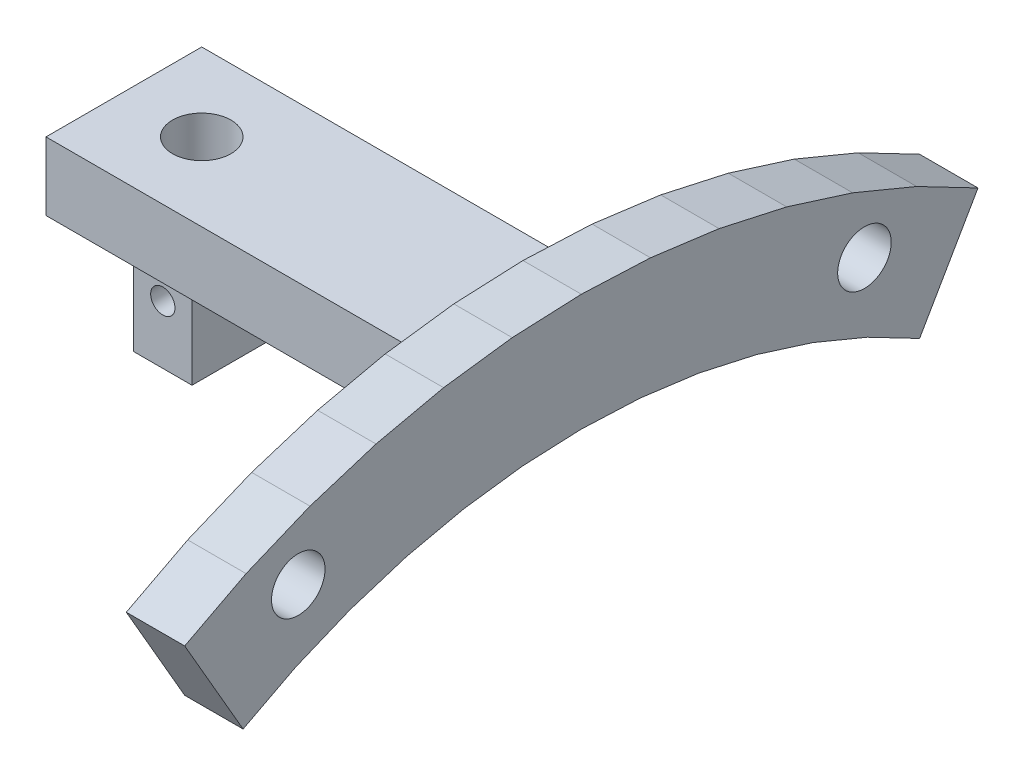
from build123d import *

# Parameters (mm, degrees)
FOOT_DEPTH                     = 6
RISER_SKETCH_W                 = 41
RISER_SKETCH_H                 = 7
RISER_DEPTH                    = 8
TAB_SKETCH_W                   = 6
TAB_SKETCH_H                   = 11.6
PUSHROD_TAB_DEPTH              = 4
PIN_HOLE_SKETCH_W              = 3
PIN_HOLE_SKETCH_H              = 7
BALL_JOINT_HOLE_SKETCH_R       = 1.25
BALL_JOINT_HOLE_DEPTH          = 5
FOOT_BOLT_HOLE_22_5_SKETCH_R   = 2.75
FOOT_BOLT_HOLE_22_5_DEPTH      = 6
FOOT_BOLT_HOLE_22_5_SKETCH_2_R = 2.75
FOOT_BOLT_HOLE_22_5_2_DEPTH    = 6


with BuildPart() as part:
    # Foot Sketch → Foot (new body)
    with BuildSketch(Plane(origin=(-9, 0, 0), x_dir=(0, 0, -1), z_dir=(1, 0, 0))):
        Polygon((-40.75, 70.581070408), (-34.443388332, 73.864084643), (-27.874641681, 76.584948594), (-21.093752176, 78.722954843), (-14.15232648, 80.26183187), (-7.103193034, 81.189867894), (0, 81.5), (7.103193034, 81.189867894), (14.15232648, 80.26183187), (21.093752176, 78.722954843), (27.874641681, 76.584948594), (34.443388332, 73.864084643), (40.75, 70.581070408), (34.75, 60.188765563), (29.371969191, 62.988391199), (23.770399961, 65.308637145), (17.987923635, 67.131844927), (12.068548348, 68.444138834), (6.057324121, 69.235531517), (0, 69.5), (-6.057324121, 69.235531517), (-12.068548348, 68.444138834), (-17.987923635, 67.131844927), (-23.770399961, 65.308637145), (-29.371969191, 62.988391199), (-34.75, 60.188765563), align=None)
    extrude(amount=-FOOT_DEPTH)

    # Riser Sketch → Riser (add, symmetric)
    with BuildSketch(Plane.XY):
        with Locations((-35.5, 72.5)):
            Rectangle(RISER_SKETCH_W, RISER_SKETCH_H)
    extrude(amount=RISER_DEPTH, both=True)

    # Tab Sketch → Pushrod Tab (add, symmetric)
    with BuildSketch(Plane.XY):
        with Locations((-48, 63.2)):
            Rectangle(TAB_SKETCH_W, TAB_SKETCH_H)
    extrude(amount=PUSHROD_TAB_DEPTH, both=True)

    # Pin Hole Sketch → Pin Hole (revolve, cut)
    with BuildSketch(Plane.XY):
        with Locations((-46.5, 73.5)):
            Rectangle(PIN_HOLE_SKETCH_W, PIN_HOLE_SKETCH_H)
    revolve(axis=Axis((-48, 59, 0), (0, 1, 0)), mode=Mode.SUBTRACT)

    # Ball Joint Hole Sketch → Ball Joint Hole (cut, symmetric)
    with BuildSketch(Plane.XY):
        with Locations((-48, 63.4)):
            Circle(BALL_JOINT_HOLE_SKETCH_R)
    extrude(amount=BALL_JOINT_HOLE_DEPTH, both=True, mode=Mode.SUBTRACT)

    # Foot Bolt Hole _22.5 Sketch → Foot Bolt Hole _22.5 (cut)
    with BuildSketch(Plane(origin=(-9, 0, 0), x_dir=(0, 0, -1), z_dir=(1, 0, 0))):
        with Locations((29.08394086, 70.214844471)):
            Circle(FOOT_BOLT_HOLE_22_5_SKETCH_R)
    extrude(amount=-FOOT_BOLT_HOLE_22_5_DEPTH, mode=Mode.SUBTRACT)

    # Foot Bolt Hole -22.5 Sketch 2 → Foot Bolt Hole -22.5 2 (cut)
    with BuildSketch(Plane(origin=(-9, 0, 0), x_dir=(0, 0, -1), z_dir=(1, 0, 0))):
        with Locations((-29.08394086, 70.214844471)):
            Circle(FOOT_BOLT_HOLE_22_5_SKETCH_2_R)
    extrude(amount=-FOOT_BOLT_HOLE_22_5_2_DEPTH, mode=Mode.SUBTRACT)


solid = part.part
